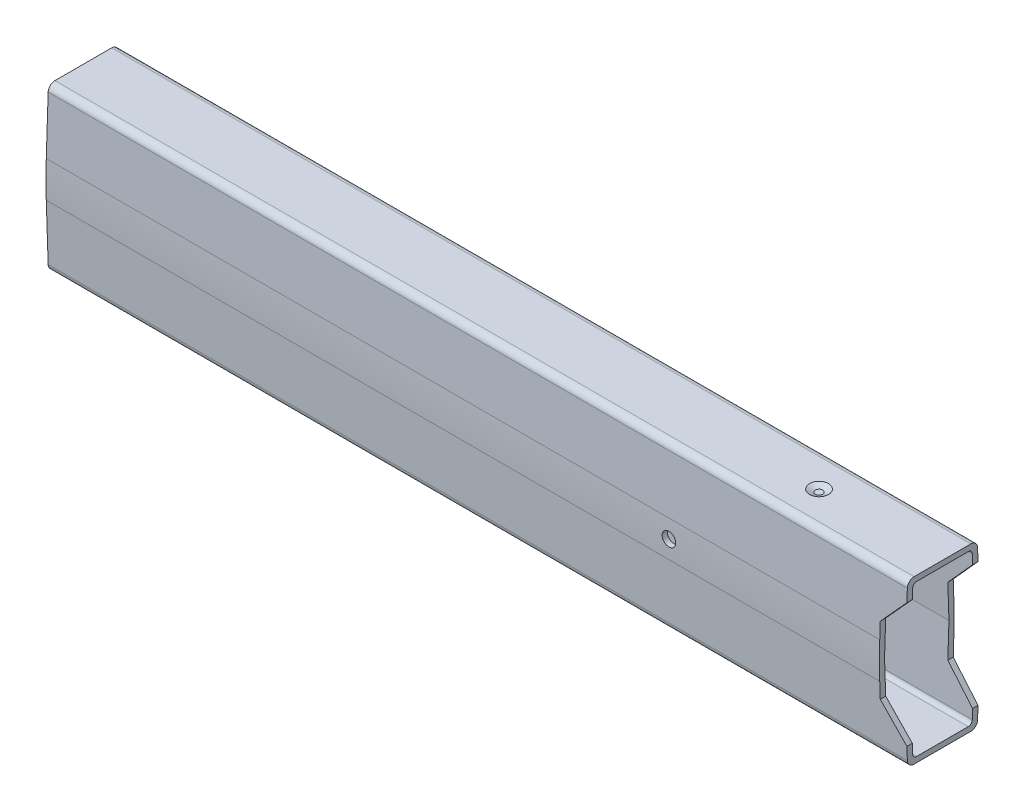
from build123d import *
from build123d.topology import SkipClean

# Parameters (mm, degrees)
SKETCH1_W                     = 80.645
SKETCH1_H                     = 7.0612
BOSS_EXTRUDE1_DEPTH           = 7.62
BOSS_EXTRUDE1_TAPER           = 1.909
BOSS_EXTRUDE1_OTHER_WAY_DEPTH = 7.62
BOSS_EXTRUDE1_OTHER_WAY_TAPER = 1.909
CUT_EXTRUDE1_DEPTH            = 82.311383
FILLET2_R                     = 0.635
FILLET3_R                     = 0.381
FILLET4_R                     = 50.8
BOSS_EXTRUDE2_DEPTH           = 80.645
CUT_EXTRUDE2_DEPTH            = 82.308938
SKETCH7_R                     = 0.635
CUT_EXTRUDE3_DEPTH            = 1.27
SKETCH8_R                     = 0.889
CUT_EXTRUDE4_DEPTH            = 0.254
CUT_EXTRUDE4_DRAFT            = -65
SKETCH9_R                     = 0.889
CUT_EXTRUDE5_DEPTH            = 0.254
CUT_EXTRUDE5_DRAFT            = -65
CUT_EXTRUDE6_START            = 6.175959
CUT_EXTRUDE6_DEPTH            = 0.881322
BOSS_EXTRUDE3_REACH           = 83.309


# Read off the part's stored shape, not the designer's step: Cut-Extrude6
with BuildPart() as part:
    # Sketch1 → Boss-Extrude1 (new body)
    with BuildSketch(Plane(origin=(0, 0, 0), x_dir=(1, 0, 0), z_dir=(0, 1, 0))):
        with Locations((40.3225, 3.5306)):
            Rectangle(SKETCH1_W, SKETCH1_H)
    extrude(amount=BOSS_EXTRUDE1_DEPTH, taper=BOSS_EXTRUDE1_TAPER)

    # Sketch1 → Boss-Extrude1 other way (add)
    with BuildSketch(Plane(origin=(0, 0, 0), x_dir=(1, 0, 0), z_dir=(0, 1, 0))):
        with Locations((40.3225, 3.5306)):
            Rectangle(SKETCH1_W, SKETCH1_H)
    extrude(amount=-BOSS_EXTRUDE1_OTHER_WAY_DEPTH, taper=BOSS_EXTRUDE1_OTHER_WAY_TAPER)

    # Sketch4 → Cut-Extrude1 (cut, through all)
    with BuildSketch(Plane(origin=(0, 0, 0), x_dir=(0, 0, -1), z_dir=(1, 0, 0))):
        Polygon((6.552918, 0), (6.31587, 7.112), (0.74533, 7.112), (0.508282, 0), (0.74533, -7.112), (6.31587, -7.112), align=None)
    extrude(amount=CUT_EXTRUDE1_DEPTH, mode=Mode.SUBTRACT)

    # Fillet2
    fillet2_edges = [part.edges().sort_by_distance(p)[0] for p in [
        (40.3225, -7.62, -6.80722),
        (40.3225, 7.62, -0.25398),
        (40.3225, 7.62, -6.80722),
        (40.3225, -7.62, -0.25398),
    ]]
    fillet(fillet2_edges, radius=FILLET2_R)

    # Fillet3
    fillet3_edges = [part.edges().sort_by_distance(p)[0] for p in [
        (40.3225, 7.112, -6.31587),
        (40.3225, 7.112, -0.74533),
        (40.3225, -7.112, -6.31587),
        (40.3225, -7.112, -0.74533),
    ]]
    fillet(fillet3_edges, radius=FILLET3_R)

    # Fillet4
    # the kernel refuses this fillet: 50.8 mm, written as the material it takes off along each edge
    with BuildSketch(Plane(origin=(84.877995, 0, -7.0612), x_dir=(0, 0.9994449956083129, 0.03331217125165235), z_dir=(-1, 0, 0)), Plane(origin=(-4.232995, 0, 0), x_dir=(0, 0.999444995608313, -0.03331217125165188), z_dir=(1, 0, 0))) as fillet4_piece_1:
        with BuildLine():
            CenterArc((FILLET4_R * 0.0333306699198, -FILLET4_R), FILLET4_R, 90, 3.818)
            Line((-FILLET4_R * 0.0332566957808, -FILLET4_R * 0.002219401507), (0, 0))
            Line((0, 0), (FILLET4_R * 0.0333306699198, 0))
        make_face()
    extrude(amount=89.11099, mode=Mode.SUBTRACT)

    # Sketch5 → Boss-Extrude2 (add)
    with SkipClean():  # the faces are left unmerged after this step: merging them gives an invalid solid
        with BuildSketch(Plane(origin=(0, 0, 0), x_dir=(0, 0, -1), z_dir=(1, 0, 0))):
            with BuildLine():
                Line((6.82768, 7.006153), (7.004796, 1.692258))
                ThreePointArc((7.004796, 1.692258), (7.025941, 0.846247), (7.03299, 0))
                ThreePointArc((7.03299, 0), (7.025941, -0.846247), (7.004796, -1.692258))
                Line((7.004796, -1.692258), (6.82768, -7.006153))
                ThreePointArc((6.82768, -7.006153), (6.634503, -7.44143), (6.193033, -7.62))
                Line((6.193033, -7.62), (0.868167, -7.62))
                ThreePointArc((0.868167, -7.62), (0.426697, -7.44143), (0.23352, -7.006153))
                Line((0.23352, -7.006153), (0.056404, -1.692258))
                ThreePointArc((0.056404, -1.692258), (0.035259, -0.846247), (0.02821, 0))
                ThreePointArc((0.02821, 0), (0.035259, 0.846247), (0.056404, 1.692258))
                Line((0.056404, 1.692258), (0.23352, 7.006153))
                ThreePointArc((0.23352, 7.006153), (0.426697, 7.44143), (0.868167, 7.62))
                Line((0.868167, 7.62), (6.193033, 7.62))
                ThreePointArc((6.193033, 7.62), (6.634503, 7.44143), (6.82768, 7.006153))
            make_face()
            with BuildLine():
                Line((6.328146, 6.743692), (6.552918, 0))
                Line((6.552918, 0), (6.328146, -6.743692))
                ThreePointArc((6.328146, -6.743692), (6.21224, -7.004858), (5.947358, -7.112))
                Line((5.947358, -7.112), (1.113842, -7.112))
                ThreePointArc((1.113842, -7.112), (0.84896, -7.004858), (0.733054, -6.743692))
                Line((0.733054, -6.743692), (0.508282, 0))
                Line((0.508282, 0), (0.733054, 6.743692))
                ThreePointArc((0.733054, 6.743692), (0.84896, 7.004858), (1.113842, 7.112))
                Line((1.113842, 7.112), (5.947358, 7.112))
                ThreePointArc((5.947358, 7.112), (6.21224, 7.004858), (6.328146, 6.743692))
            make_face(mode=Mode.SUBTRACT)
        extrude(amount=BOSS_EXTRUDE2_DEPTH)

    # Sketch6 → Cut-Extrude2 (cut, through all)
    with SkipClean():  # the faces are left unmerged after this step: merging them gives an invalid solid
        with BuildSketch(Plane.XY):
            Polygon((80.645, 5.842), (80.645, -5.842), (78.232, -3.175), (78.232, 3.175), align=None)
        extrude(amount=-CUT_EXTRUDE2_DEPTH, mode=Mode.SUBTRACT)

    # Sketch7 → Cut-Extrude3 (cut)
    with SkipClean():  # the faces are left unmerged after this step: merging them gives an invalid solid
        with BuildSketch(Plane.XY):
            with Locations((58.4708, 0)):
                Circle(SKETCH7_R)
        extrude(amount=-CUT_EXTRUDE3_DEPTH, mode=Mode.SUBTRACT)


with BuildPart() as cut_extrude4_tool:
    # Sketch8 → Cut-Extrude4 (with draft: the straight prism first)
    with BuildSketch(Plane(origin=(0, -7.62, 0), x_dir=(-1, 0, 0), z_dir=(0, -1, 0))):
        with Locations((-69.0626, 3.5306)):
            Circle(SKETCH8_R)
    extrude(amount=-CUT_EXTRUDE4_DEPTH)
    # Cut-Extrude4: the draft: its side faces are tilted about the plane it starts from
    cut_extrude4_sides = [cut_extrude4_tool.faces().sort_by_distance(p)[0] for p in [
        (69.9516, -7.493, -3.5306),
    ]]
    draft(cut_extrude4_sides, Plane(origin=(0, -7.62, 0), x_dir=(-1, 0, 0), z_dir=(0, -1, 0)), CUT_EXTRUDE4_DRAFT)


with BuildPart() as part_1:
    add(part.part)

    # Cut-Extrude4: cut by cut_extrude4_tool
    add(cut_extrude4_tool.part, mode=Mode.SUBTRACT)


with BuildPart() as cut_extrude5_tool:
    # Sketch9 → Cut-Extrude5 (with draft: the straight prism first)
    with BuildSketch(Plane(origin=(0, 7.62, 0), x_dir=(1, 0, 0), z_dir=(0, 1, 0))):
        with Locations((69.0626, 3.5306)):
            Circle(SKETCH9_R)
    extrude(amount=-CUT_EXTRUDE5_DEPTH)
    # Cut-Extrude5: the draft: its side faces are tilted about the plane it starts from
    cut_extrude5_sides = [cut_extrude5_tool.faces().sort_by_distance(p)[0] for p in [
        (68.1736, 7.493, -3.5306),
    ]]
    draft(cut_extrude5_sides, Plane(origin=(0, 7.62, 0), x_dir=(1, 0, 0), z_dir=(0, 1, 0)), CUT_EXTRUDE5_DRAFT)


with BuildPart() as part_2:
    add(part_1.part)

    # Cut-Extrude5: cut by cut_extrude5_tool
    add(cut_extrude5_tool.part, mode=Mode.SUBTRACT)

    # Cut-Extrude6 outline → Cut-Extrude6 (cut)
    with SkipClean():  # the faces are left unmerged after this step: merging them gives an invalid solid
        with BuildSketch(Plane(origin=(0, 0, 0), x_dir=(1, 0, 0), z_dir=(0, 0.0333121712516467, -0.9994449956083131)).offset(CUT_EXTRUDE6_START)):
            with BuildLine():
                Line((3.175214, -5.357454), (3.810214, -5.357454))
                add(Edge.make_bspline(
                    [(3.810214, -5.357454), (3.810214, -4.468947), (4.699214, -4.468947)],
                    knots=[0, 0, 0, 1.570796, 1.570796, 1.570796], degree=2, weights=[1, 0.707107, 1]))
                Line((4.699214, -4.468947), (8.001214, -4.468947))
                Line((8.001214, -4.468947), (8.001214, -3.8343))
                Line((8.001214, -3.8343), (4.699214, -3.8343))
                add(Edge.make_bspline(
                    [(4.699214, -3.8343), (3.175214, -3.8343), (3.175214, -5.357454)],
                    knots=[3.141593, 3.141593, 3.141593, 4.712389, 4.712389, 4.712389], degree=2, weights=[1, 0.707107, 1]))
            make_face()
            with BuildLine():
                Line((8.001214, -2.522695), (4.699214, -2.522695))
                add(Edge.make_bspline(
                    [(4.699214, -2.522695), (3.810214, -2.522695), (3.810214, -1.634188), (3.810214, -0.745682), (4.699214, -0.745682)],
                    knots=[0, 0, 0, 1.570796, 1.570796, 3.141593, 3.141593, 3.141593], degree=2, weights=[1, 0.707107, 1, 0.707107, 1]))
                Line((4.699214, -0.745682), (8.001214, -0.745682))
                Line((8.001214, -0.745682), (8.001214, -0.111034))
                Line((8.001214, -0.111034), (4.699214, -0.111034))
                add(Edge.make_bspline(
                    [(4.699214, -0.111034), (3.175214, -0.111034), (3.175214, -1.634188), (3.175214, -3.157342), (4.699214, -3.157342)],
                    knots=[1.570796, 1.570796, 1.570796, 3.141593, 3.141593, 4.712389, 4.712389, 4.712389], degree=2, weights=[1, 0.707107, 1, 0.707107, 1]))
                Line((4.699214, -3.157342), (8.001214, -3.157342))
                Line((8.001214, -3.157342), (8.001214, -2.522695))
            make_face()
            with BuildLine():
                Line((3.810214, 5.812343), (3.175214, 5.812343))
                add(Edge.make_bspline(
                    [(3.175214, 5.812343), (3.175214, 4.289189), (4.699214, 4.289189)],
                    knots=[3.141593, 3.141593, 3.141593, 4.712389, 4.712389, 4.712389], degree=2, weights=[1, 0.707107, 1]))
                Line((4.699214, 4.289189), (8.001214, 4.289189))
                Line((8.001214, 4.289189), (8.001214, 4.923837))
                Line((8.001214, 4.923837), (4.699214, 4.923837))
                add(Edge.make_bspline(
                    [(4.699214, 4.923837), (3.810214, 4.923837), (3.810214, 5.812343)],
                    knots=[1.570796, 1.570796, 1.570796, 3.141593, 3.141593, 3.141593], degree=2, weights=[1, 0.707107, 1]))
            make_face()
            with BuildLine():
                Line((8.001214, 3.612232), (4.699214, 3.612232))
                add(Edge.make_bspline(
                    [(4.699214, 3.612232), (3.175214, 3.612232), (3.175214, 2.089078), (3.175214, 0.565924), (4.699214, 0.565924)],
                    knots=[0, 0, 0, 1.570796, 1.570796, 3.141593, 3.141593, 3.141593], degree=2, weights=[1, 0.707107, 1, 0.707107, 1]))
                Line((4.699214, 0.565924), (8.001214, 0.565924))
                Line((8.001214, 0.565924), (8.001214, 1.200571))
                Line((8.001214, 1.200571), (4.699214, 1.200571))
                add(Edge.make_bspline(
                    [(4.699214, 1.200571), (3.810214, 1.200571), (3.810214, 2.089078), (3.810214, 2.977585), (4.699214, 2.977585)],
                    knots=[0, 0, 0, 1.570796, 1.570796, 3.141593, 3.141593, 3.141593], degree=2, weights=[1, 0.707107, 1, 0.707107, 1]))
                Line((4.699214, 2.977585), (8.001214, 2.977585))
                Line((8.001214, 2.977585), (8.001214, 3.612232))
            make_face()
        extrude(amount=CUT_EXTRUDE6_DEPTH, mode=Mode.SUBTRACT)

    # Boss-Extrude3: up to this face of the body (flat: up to its plane)
    boss_extrude3_end = Plane(part_2.part.faces().sort_by_distance((8.001214, -0.659159, -6.77958))[0])
    # Sketch12 → Boss-Extrude3 (add, up to the picked face)
    with BuildSketch(Plane.ZY, mode=Mode.PRIVATE) as boss_extrude3_sk1:
        Polygon((-6.954024, 1.690566), (-6.776908, 7.004461), (-6.328146, 6.743692), (-6.552918, 0), (-6.328146, -6.743692), (-6.776908, -7.004461), (-6.954024, -1.690566), (-7.010372, 0), align=None)
    boss_extrude3_tool1 = split(extrude(boss_extrude3_sk1.sketch, amount=-BOSS_EXTRUDE3_REACH, mode=Mode.PRIVATE), bisect_by=boss_extrude3_end, keep=Keep.BOTH, mode=Mode.PRIVATE)
    add(boss_extrude3_tool1.solids().sort_by(Axis((0, 0, -6.668518), (1, 0, 0)))[0])


solid = part_2.part
